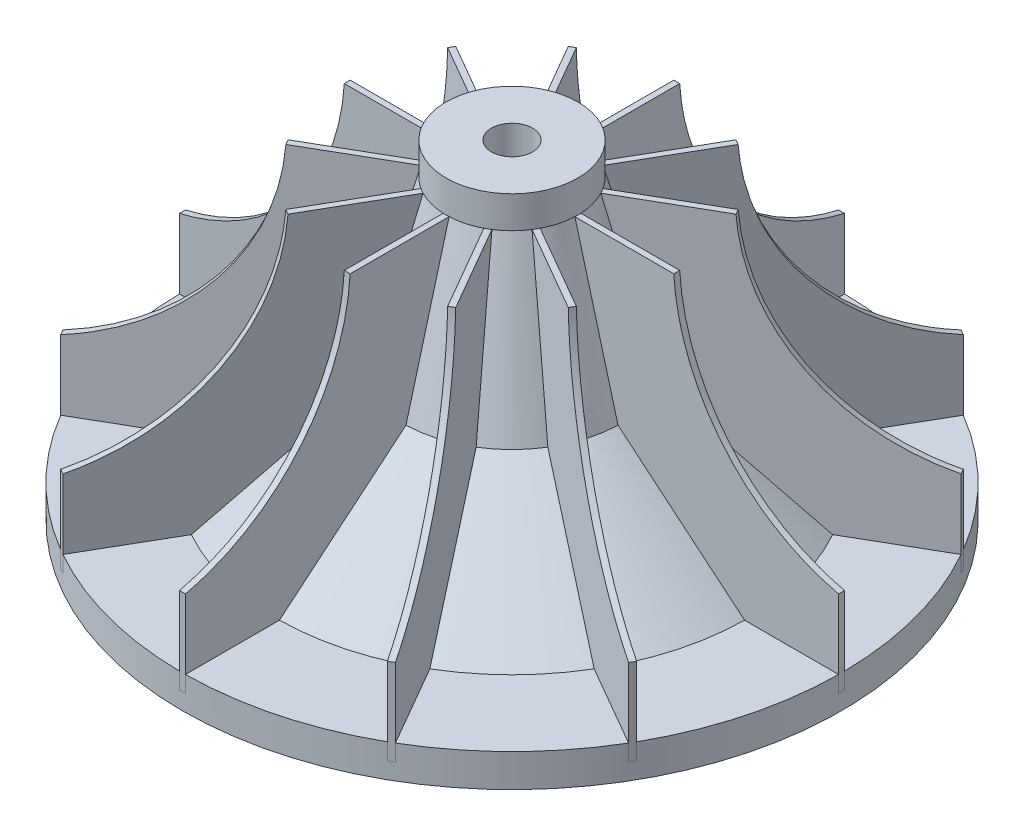
from build123d import *

# Parameters (mm, degrees)
SKETCH3_W           = 0.91186
SKETCH3_H           = 41.91
BOSS_EXTRUDE5_DEPTH = 48.26
CIRPATTERN8_COUNT   = 12
CUT_EXTRUDE1_REACH  = 89.988
SKETCH6_R           = 3.175


with BuildPart() as part:
    # Sketch1 → Revolve1 (revolve)
    with BuildSketch(Plane.XY):
        Polygon((0, 0), (-50.8, 0), (-50.8, 5.08), (-36.306033809, 5.08), (-16.802789754, 21.352168612), (-10.16, 45.868150017), (-10.16, 50.8), (0, 50.8), align=None)
    revolve(axis=Axis((0, 0, 0), (0, 1, 0)))

    # Sketch3 → Boss-Extrude5 (add)
    with BuildSketch(Plane(origin=(0, 50.8, 0), x_dir=(1, 0, 0), z_dir=(0, 1, 0))):
        with Locations((0, -29.845)):
            Rectangle(SKETCH3_W, SKETCH3_H)
    boss_extrude5 = extrude(amount=-BOSS_EXTRUDE5_DEPTH)

    # CirPattern8: Boss-Extrude5 ×12 about axis
    cirpattern8_axis = Axis((0, 5.08, 0), (0, -1, 0))
    for i in range(1, CIRPATTERN8_COUNT):
        add(boss_extrude5.rotate(cirpattern8_axis, i * 360 / CIRPATTERN8_COUNT))

    # Sketch4 → Cut-Revolve1 (revolve, cut)
    with BuildSketch(Plane(origin=(0, 0, 0), x_dir=(0, 0, -1), z_dir=(1, 0, 0))):
        with BuildLine():
            Line((-53.34, 58.568150017), (-53.34, 15.388150017))
            Line((-53.34, 15.388150017), (-53.132221554, 15.388150017))
            ThreePointArc((-53.132221554, 15.388150017), (-33.885549763, 25.732647717), (-25.4, 45.868150017))
            Line((-25.4, 45.868150017), (-10.16, 45.868150017))
            Line((-10.16, 45.868150017), (-10.16, 51.095928276))
            Line((-10.16, 51.095928276), (-10.16, 59.620689016))
            Line((-10.16, 59.620689016), (-53.34, 58.568150017))
        make_face()
    revolve(axis=Axis((0, 0, 0), (0, 1, 0)), mode=Mode.SUBTRACT)

    # Sketch6 → Cut-Extrude1 (cut, up to next)
    with BuildSketch(Plane(origin=(0, 50.8, 0), x_dir=(1, 0, 0), z_dir=(0, 1, 0)), mode=Mode.PRIVATE) as cut_extrude1_sk1:
        Circle(SKETCH6_R)
    cut_extrude1_tool1 = extrude(cut_extrude1_sk1.sketch, amount=-CUT_EXTRUDE1_REACH, mode=Mode.PRIVATE) & part.part
    add(cut_extrude1_tool1.solids().sort_by_distance((0, 50.8, 0))[0], mode=Mode.SUBTRACT)


solid = part.part
